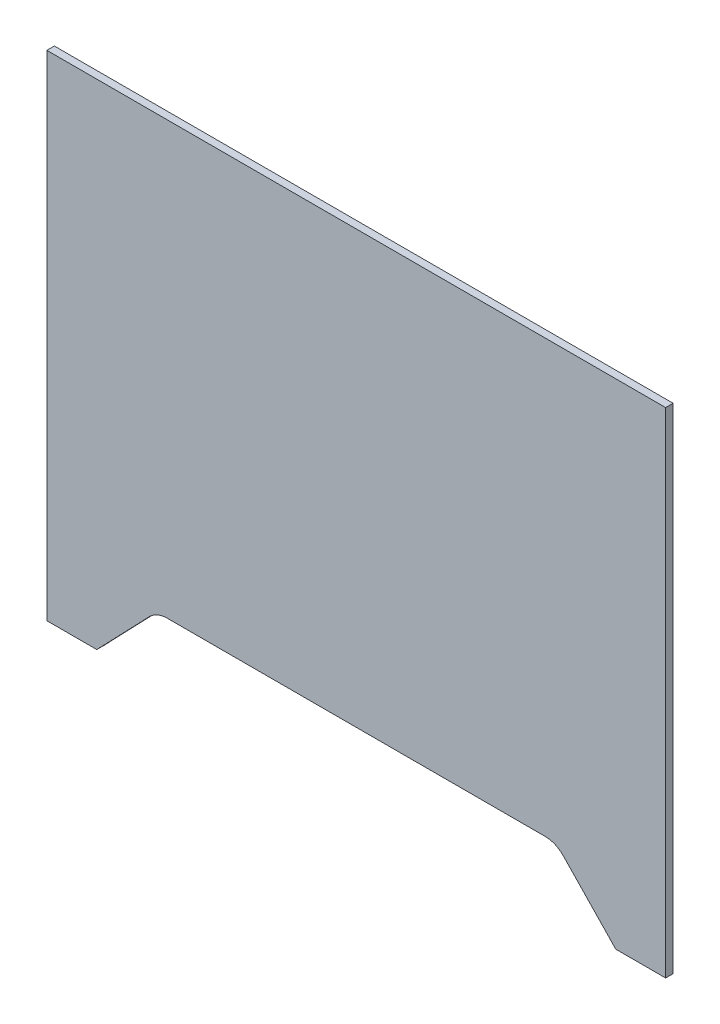
from build123d import *

# Parameters (mm, degrees)
BOSS_EXTRUDE1_DEPTH = 3


with BuildPart() as part:
    # Sketch1 → Boss-Extrude1 (new body)
    with BuildSketch(Plane.XY):
        with BuildLine():
            Line((-124, -99), (-124, 99))
            Line((-124, 99), (124, 99))
            Line((124, 99), (124, -99))
            Line((124, -99), (104, -99))
            Line((104, -99), (82.951694449, -77.074681718))
            ThreePointArc((82.951694449, -77.074681718), (79.65871509, -74.800728757), (75.737821239, -74))
            Line((75.737821239, -74), (-75.737821239, -74))
            ThreePointArc((-75.737821239, -74), (-79.65871509, -74.800728757), (-82.951694449, -77.074681718))
            Line((-82.951694449, -77.074681718), (-104, -99))
            Line((-104, -99), (-124, -99))
        make_face()
    extrude(amount=BOSS_EXTRUDE1_DEPTH)


solid = part.part
